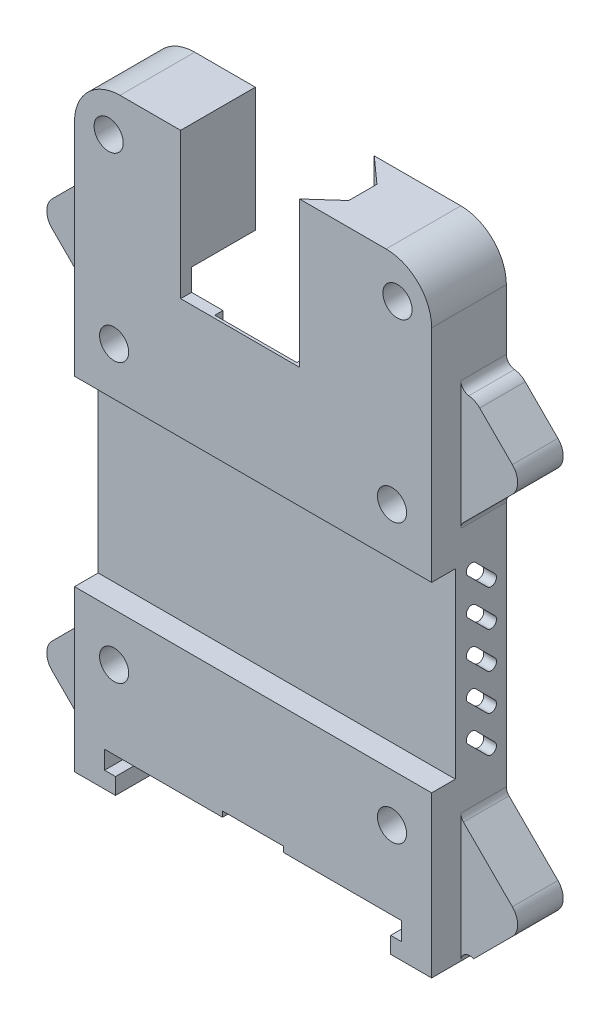
from build123d import *

# Parameters (mm, degrees)
BASE_BODY_DEPTH                     = 8.2
PCB_START                           = -1.95
SKETCH5_W                           = 36.4
SKETCH5_H                           = 46.4
PCB_CUT_DEPTH                       = 1.95
BOTTOM_REACH                        = 57.07
SKETCH7_W                           = 1.2
SKETCH7_H                           = 46.4
SKETCH7_W_2                         = 3.6
SKETCH7_H_2                         = 22
HOLE_CUT_REACH                      = 46.382
SKETCH25_R                          = 1.6
HOLE_CUT_DIRECTION_2_REACH          = 46.382
BATTERY_STRAP_CUT_REACH             = 57.07
SKETCH9_W                           = 2.6
SKETCH9_H                           = 20
BATTERY_STRAP_CUT_DIRECTION_2_REACH = 57.07
SKETCH11_W                          = 4.5
SKETCH11_H                          = 8.2
LED_STRIP_HOLDER_DEPTH              = 3
LED_STRIP_CUT_REACH                 = 46.587
SKETCH14_W                          = 32.6
SKETCH14_H                          = 2
SKETCH15_R                          = 0.8
LED_STRIP_HOLE_HOLDER_DEPTH         = 0.7
LED_STRIP_WIRE_HOLE_REACH           = 67.918
XT60_CUT_DEPTH                      = 16
SKETCH21_W                          = 8.85
SKETCH21_H                          = 9
WIRE_POCKET_DEPTH                   = 7
ESC_WIRE_EXTRUDE_DEPTH              = 5
ESC_WIRE_POCKET_DEPTH               = 3.8
MIRROR_TOP_BOTTOM_COPY_1_DEPTH      = 5
MIRROR_TOP_BOTTOM_COPY_2_DEPTH      = 3.8
INNER_FILLET_R                      = 2
OUTER_FILLET_R                      = 1
FILLET2_R                           = 2
VENTILATION_CUT_DEPTH               = 61.571557621
VENTILATION_CUT_DEPTH_BACK          = 61.571557621
FILLET1_R                           = 5
CAPACITOR_CUT_REACH                 = 49.663
SKETCH26_W                          = 18.7
SKETCH26_H                          = 2.4
SKETCH27_W                          = 9
SKETCH27_H                          = 11.6
CUT_EXTRUDE2_DEPTH                  = 0.9
CUT_EXTRUDE3_REACH                  = 49.663
SKETCH28_W                          = 6.7
SKETCH28_H                          = 0.6


with BuildPart() as part:
    # Sketch3 → Base body (new body)
    with BuildSketch(Plane.XY):
        Polygon((-18.2, 23.2), (-7.85, 23.2), (-7.85, 39.2), (-19.6, 39.2), (-19.6, -24.6), (19.6, -24.6), (19.6, 39.2), (4.95, 39.2), (4.95, 23.2), (18.2, 23.2), (18.2, 18.2), (18.2, 15.25), (18.2, 12.3), (18.2, -12.3), (18.2, -15.25), (18.2, -18.2), (18.2, -23.2), (-18.2, -23.2), (-18.2, -18.2), (-18.2, -15.25), (-18.2, -12.3), (-18.2, 12.3), (-18.2, 15.249999986), (-18.2, 18.2), align=None)
        with BuildLine():
            Line((-15.25, 18.2), (-18, 18.2))
            Line((-18, 18.2), (-18, 16.317707825))
            ThreePointArc((-18, 16.317707825), (-16.916247568, 17.684362143), (-15.25, 18.2))
        make_face()
        with BuildLine():
            ThreePointArc((-15.25, 18.2), (-16.916247568, 17.684362143), (-18, 16.317707825))
            Line((-18, 16.317707825), (-18, 14.182292175))
            ThreePointArc((-18, 14.182292175), (-16.916247568, 12.815637857), (-15.25, 12.3))
            ThreePointArc((-15.25, 12.3), (-13.164034995, 13.164034995), (-12.3, 15.25))
            ThreePointArc((-12.3, 15.25), (-13.164034995, 17.335965005), (-15.25, 18.2))
        make_face()
        with BuildLine():
            ThreePointArc((-15.25, 12.3), (-16.916247568, 12.815637857), (-18, 14.182292175))
            Line((-18, 14.182292175), (-18, 12.3))
            Line((-18, 12.3), (-15.25, 12.3))
        make_face()
        with BuildLine():
            Line((18, 16.317707825), (18, 18.2))
            Line((18, 18.2), (15.25, 18.2))
            ThreePointArc((15.25, 18.2), (16.916247568, 17.684362143), (18, 16.317707825))
        make_face()
        with BuildLine():
            Line((18, 12.3), (18, 14.182292175))
            ThreePointArc((18, 14.182292175), (16.916247568, 12.815637857), (15.25, 12.3))
            Line((15.25, 12.3), (18, 12.3))
        make_face()
        with BuildLine():
            Line((18, 14.182292175), (18, 16.317707825))
            ThreePointArc((18, 16.317707825), (16.916247568, 17.684362143), (15.25, 18.2))
            ThreePointArc((15.25, 18.2), (12.3, 15.25), (15.25, 12.3))
            ThreePointArc((15.25, 12.3), (16.916247568, 12.815637857), (18, 14.182292175))
        make_face()
        with BuildLine():
            Line((18, -16.317707825), (18, -14.182292175))
            ThreePointArc((18, -14.182292175), (16.916247568, -12.815637857), (15.25, -12.3))
            ThreePointArc((15.25, -12.3), (12.3, -15.25), (15.25, -18.2))
            ThreePointArc((15.25, -18.2), (16.916247568, -17.684362143), (18, -16.317707825))
        make_face()
        with BuildLine():
            Line((18, -14.182292175), (18, -12.3))
            Line((18, -12.3), (15.25, -12.3))
            ThreePointArc((15.25, -12.3), (16.916247568, -12.815637857), (18, -14.182292175))
        make_face()
        with BuildLine():
            Line((18, -18.2), (18, -16.317707825))
            ThreePointArc((18, -16.317707825), (16.916247568, -17.684362143), (15.25, -18.2))
            Line((15.25, -18.2), (18, -18.2))
        make_face()
        with BuildLine():
            ThreePointArc((-15.25, -12.3), (-16.916247568, -12.815637857), (-18, -14.182292175))
            Line((-18, -14.182292175), (-18, -16.317707825))
            ThreePointArc((-18, -16.317707825), (-16.916247568, -17.684362143), (-15.25, -18.2))
            ThreePointArc((-15.25, -18.2), (-13.164034995, -17.335965005), (-12.3, -15.25))
            ThreePointArc((-12.3, -15.25), (-13.164034995, -13.164034995), (-15.25, -12.3))
        make_face()
        with BuildLine():
            Line((-15.25, -12.3), (-18, -12.3))
            Line((-18, -12.3), (-18, -14.182292175))
            ThreePointArc((-18, -14.182292175), (-16.916247568, -12.815637857), (-15.25, -12.3))
        make_face()
        with BuildLine():
            ThreePointArc((-15.25, -18.2), (-16.916247568, -17.684362143), (-18, -16.317707825))
            Line((-18, -16.317707825), (-18, -18.2))
            Line((-18, -18.2), (-15.25, -18.2))
        make_face()
        with BuildLine():
            Line((-18, -14.182292175), (-18, -12.3))
            Line((-18, -12.3), (-18.2, -12.3))
            Line((-18.2, -12.3), (-18.2, -15.25))
            ThreePointArc((-18.2, -15.25), (-18.149568933, -14.706860975), (-18, -14.182292175))
        make_face()
        with BuildLine():
            Line((-18, -16.317707825), (-18, -14.182292175))
            ThreePointArc((-18, -14.182292175), (-18.149568933, -14.706860975), (-18.2, -15.25))
            ThreePointArc((-18.2, -15.25), (-18.149568933, -15.793139025), (-18, -16.317707825))
        make_face()
        with BuildLine():
            ThreePointArc((-18, -16.317707825), (-18.149568933, -15.793139025), (-18.2, -15.25))
            Line((-18.2, -15.25), (-18.2, -18.2))
            Line((-18.2, -18.2), (-18, -18.2))
            Line((-18, -18.2), (-18, -16.317707825))
        make_face()
        with BuildLine():
            Line((-18, 16.317707825), (-18, 18.2))
            Line((-18, 18.2), (-18.2, 18.2))
            Line((-18.2, 18.2), (-18.2, 15.249999986))
            ThreePointArc((-18.2, 15.249999986), (-18.149568935, 15.793139017), (-18, 16.317707825))
        make_face()
        with BuildLine():
            Line((-18, 14.182292175), (-18, 16.317707825))
            ThreePointArc((-18, 16.317707825), (-18.149568935, 15.793139017), (-18.2, 15.249999986))
            ThreePointArc((-18.2, 15.249999986), (-18.149568932, 14.706860968), (-18, 14.182292175))
        make_face()
        with BuildLine():
            Line((-18, 12.3), (-18, 14.182292175))
            ThreePointArc((-18, 14.182292175), (-18.149568932, 14.706860968), (-18.2, 15.249999986))
            Line((-18.2, 15.249999986), (-18.2, 12.3))
            Line((-18.2, 12.3), (-18, 12.3))
        make_face()
        with BuildLine():
            Line((18.2, 18.2), (18, 18.2))
            Line((18, 18.2), (18, 16.317707825))
            ThreePointArc((18, 16.317707825), (18.149568933, 15.793139025), (18.2, 15.25))
            Line((18.2, 15.25), (18.2, 18.2))
        make_face()
        with BuildLine():
            ThreePointArc((18.2, 15.25), (18.149568933, 15.793139025), (18, 16.317707825))
            Line((18, 16.317707825), (18, 14.182292175))
            ThreePointArc((18, 14.182292175), (18.149568933, 14.706860975), (18.2, 15.25))
        make_face()
        with BuildLine():
            ThreePointArc((18.2, 15.25), (18.149568933, 14.706860975), (18, 14.182292175))
            Line((18, 14.182292175), (18, 12.3))
            Line((18, 12.3), (18.2, 12.3))
            Line((18.2, 12.3), (18.2, 15.25))
        make_face()
        with BuildLine():
            Line((18.2, -12.3), (18, -12.3))
            Line((18, -12.3), (18, -14.182292175))
            ThreePointArc((18, -14.182292175), (18.149568933, -14.706860975), (18.2, -15.25))
            Line((18.2, -15.25), (18.2, -12.3))
        make_face()
        with BuildLine():
            ThreePointArc((18.2, -15.25), (18.149568933, -14.706860975), (18, -14.182292175))
            Line((18, -14.182292175), (18, -16.317707825))
            ThreePointArc((18, -16.317707825), (18.149568933, -15.793139025), (18.2, -15.25))
        make_face()
        with BuildLine():
            Line((18.2, -18.2), (18.2, -15.25))
            ThreePointArc((18.2, -15.25), (18.149568933, -15.793139025), (18, -16.317707825))
            Line((18, -16.317707825), (18, -18.2))
            Line((18, -18.2), (18.2, -18.2))
        make_face()
    extrude(amount=BASE_BODY_DEPTH)

    # Sketch5 → PCB cut (cut)
    with BuildSketch(Plane(origin=(0, 0, 0), x_dir=(-1, 0, 0), z_dir=(0, 0, -1)).offset(PCB_START)):
        Rectangle(SKETCH5_W, SKETCH5_H)
    extrude(amount=PCB_CUT_DEPTH, mode=Mode.SUBTRACT)

    # Bottom: up to this face of the body (flat: up to its plane)
    bottom_end = Plane(part.part.faces().sort_by_distance((18.2, 0, 3.865571512))[0])
    # Sketch7 → Bottom (add, up to the picked face)
    with BuildSketch(Plane(origin=(-18.2, 0, 0), x_dir=(0, 0, -1), z_dir=(1, 0, 0)), mode=Mode.PRIVATE) as bottom_sk1:
        with Locations((-7.6, 0)):
            Rectangle(SKETCH7_W, SKETCH7_H)
    bottom_tool1 = split(extrude(bottom_sk1.sketch, amount=BOTTOM_REACH, mode=Mode.PRIVATE), bisect_by=bottom_end, keep=Keep.BOTH, mode=Mode.PRIVATE)
    # Sketch7 → Bottom (add, up to the picked face)
    with BuildSketch(Plane(origin=(-18.2, 0, 0), x_dir=(0, 0, -1), z_dir=(1, 0, 0)), mode=Mode.PRIVATE) as bottom_sk2:
        with Locations((-6.4, 0)):
            Rectangle(SKETCH7_W_2, SKETCH7_H_2)
    bottom_tool2 = split(extrude(bottom_sk2.sketch, amount=BOTTOM_REACH, mode=Mode.PRIVATE), bisect_by=bottom_end, keep=Keep.BOTH, mode=Mode.PRIVATE)
    add(bottom_tool1.solids().sort_by(Axis((-18.2, 0, 7.6), (1, 0, 0)))[0])
    add(bottom_tool2.solids().sort_by(Axis((-18.2, 0, 6.4), (1, 0, 0)))[0])

    # Sketch25 → Hole cut (cut, up to next)
    with BuildSketch(Plane(origin=(0, 0, 7), x_dir=(-1, 0, 0), z_dir=(0, 0, -1)), mode=Mode.PRIVATE) as hole_cut_sk1:
        with Locations(Location((-15.25, 15.25, 0), (0, 0, 180))):
            Circle(SKETCH25_R)
    hole_cut_tool1 = extrude(hole_cut_sk1.sketch, amount=-HOLE_CUT_REACH, mode=Mode.PRIVATE) & part.part
    # Sketch25 → Hole cut (cut, up to next)
    with BuildSketch(Plane(origin=(0, 0, 7), x_dir=(-1, 0, 0), z_dir=(0, 0, -1)), mode=Mode.PRIVATE) as hole_cut_sk2:
        with Locations(Location((15.25, 15.25, 0), (0, 0, 180))):
            Circle(SKETCH25_R)
    hole_cut_tool2 = extrude(hole_cut_sk2.sketch, amount=-HOLE_CUT_REACH, mode=Mode.PRIVATE) & part.part
    # Sketch25 → Hole cut (cut, up to next)
    with BuildSketch(Plane(origin=(0, 0, 7), x_dir=(-1, 0, 0), z_dir=(0, 0, -1)), mode=Mode.PRIVATE) as hole_cut_sk3:
        with Locations(Location((-15.25, -15.25, 0), (0, 0, 180))):
            Circle(SKETCH25_R)
    hole_cut_tool3 = extrude(hole_cut_sk3.sketch, amount=-HOLE_CUT_REACH, mode=Mode.PRIVATE) & part.part
    # Sketch25 → Hole cut (cut, up to next)
    with BuildSketch(Plane(origin=(0, 0, 7), x_dir=(-1, 0, 0), z_dir=(0, 0, -1)), mode=Mode.PRIVATE) as hole_cut_sk4:
        with Locations(Location((15.25, -15.25, 0), (0, 0, 180))):
            Circle(SKETCH25_R)
    hole_cut_tool4 = extrude(hole_cut_sk4.sketch, amount=-HOLE_CUT_REACH, mode=Mode.PRIVATE) & part.part
    # Sketch25 → Hole cut (cut, up to next)
    with BuildSketch(Plane(origin=(0, 0, 7), x_dir=(-1, 0, 0), z_dir=(0, 0, -1)), mode=Mode.PRIVATE) as hole_cut_sk5:
        with Locations(Location((15.85, 34.85, 0), (0, 0, 180))):
            Circle(SKETCH25_R)
    hole_cut_tool5 = extrude(hole_cut_sk5.sketch, amount=-HOLE_CUT_REACH, mode=Mode.PRIVATE) & part.part
    # Sketch25 → Hole cut (cut, up to next)
    with BuildSketch(Plane(origin=(0, 0, 7), x_dir=(-1, 0, 0), z_dir=(0, 0, -1)), mode=Mode.PRIVATE) as hole_cut_sk6:
        with Locations(Location((-15.85, 34.85, 0), (0, 0, 180))):
            Circle(SKETCH25_R)
    hole_cut_tool6 = extrude(hole_cut_sk6.sketch, amount=-HOLE_CUT_REACH, mode=Mode.PRIVATE) & part.part
    add(hole_cut_tool1.solids().sort_by_distance((15.25, 15.25, 7))[0], mode=Mode.SUBTRACT)
    add(hole_cut_tool2.solids().sort_by_distance((-15.25, 15.25, 7))[0], mode=Mode.SUBTRACT)
    add(hole_cut_tool3.solids().sort_by_distance((15.25, -15.25, 7))[0], mode=Mode.SUBTRACT)
    add(hole_cut_tool4.solids().sort_by_distance((-15.25, -15.25, 7))[0], mode=Mode.SUBTRACT)
    add(hole_cut_tool5.solids().sort_by_distance((-15.85, 34.85, 7))[0], mode=Mode.SUBTRACT)
    add(hole_cut_tool6.solids().sort_by_distance((15.85, 34.85, 7))[0], mode=Mode.SUBTRACT)

    # Sketch25 → Hole cut direction 2 (cut, up to next)
    with BuildSketch(Plane(origin=(0, 0, 7), x_dir=(-1, 0, 0), z_dir=(0, 0, -1)), mode=Mode.PRIVATE) as hole_cut_direction_2_sk1:
        with Locations(Location((-15.25, 15.25, 0), (0, 0, 180))):
            Circle(SKETCH25_R)
    hole_cut_direction_2_tool1 = extrude(hole_cut_direction_2_sk1.sketch, amount=HOLE_CUT_DIRECTION_2_REACH, mode=Mode.PRIVATE) & part.part
    # Sketch25 → Hole cut direction 2 (cut, up to next)
    with BuildSketch(Plane(origin=(0, 0, 7), x_dir=(-1, 0, 0), z_dir=(0, 0, -1)), mode=Mode.PRIVATE) as hole_cut_direction_2_sk2:
        with Locations(Location((15.25, 15.25, 0), (0, 0, 180))):
            Circle(SKETCH25_R)
    hole_cut_direction_2_tool2 = extrude(hole_cut_direction_2_sk2.sketch, amount=HOLE_CUT_DIRECTION_2_REACH, mode=Mode.PRIVATE) & part.part
    # Sketch25 → Hole cut direction 2 (cut, up to next)
    with BuildSketch(Plane(origin=(0, 0, 7), x_dir=(-1, 0, 0), z_dir=(0, 0, -1)), mode=Mode.PRIVATE) as hole_cut_direction_2_sk3:
        with Locations(Location((-15.25, -15.25, 0), (0, 0, 180))):
            Circle(SKETCH25_R)
    hole_cut_direction_2_tool3 = extrude(hole_cut_direction_2_sk3.sketch, amount=HOLE_CUT_DIRECTION_2_REACH, mode=Mode.PRIVATE) & part.part
    # Sketch25 → Hole cut direction 2 (cut, up to next)
    with BuildSketch(Plane(origin=(0, 0, 7), x_dir=(-1, 0, 0), z_dir=(0, 0, -1)), mode=Mode.PRIVATE) as hole_cut_direction_2_sk4:
        with Locations(Location((15.25, -15.25, 0), (0, 0, 180))):
            Circle(SKETCH25_R)
    hole_cut_direction_2_tool4 = extrude(hole_cut_direction_2_sk4.sketch, amount=HOLE_CUT_DIRECTION_2_REACH, mode=Mode.PRIVATE) & part.part
    # Sketch25 → Hole cut direction 2 (cut, up to next)
    with BuildSketch(Plane(origin=(0, 0, 7), x_dir=(-1, 0, 0), z_dir=(0, 0, -1)), mode=Mode.PRIVATE) as hole_cut_direction_2_sk5:
        with Locations(Location((15.85, 34.85, 0), (0, 0, 180))):
            Circle(SKETCH25_R)
    hole_cut_direction_2_tool5 = extrude(hole_cut_direction_2_sk5.sketch, amount=HOLE_CUT_DIRECTION_2_REACH, mode=Mode.PRIVATE) & part.part
    # Sketch25 → Hole cut direction 2 (cut, up to next)
    with BuildSketch(Plane(origin=(0, 0, 7), x_dir=(-1, 0, 0), z_dir=(0, 0, -1)), mode=Mode.PRIVATE) as hole_cut_direction_2_sk6:
        with Locations(Location((-15.85, 34.85, 0), (0, 0, 180))):
            Circle(SKETCH25_R)
    hole_cut_direction_2_tool6 = extrude(hole_cut_direction_2_sk6.sketch, amount=HOLE_CUT_DIRECTION_2_REACH, mode=Mode.PRIVATE) & part.part
    add(hole_cut_direction_2_tool1.solids().sort_by_distance((15.25, 15.25, 7))[0], mode=Mode.SUBTRACT)
    add(hole_cut_direction_2_tool2.solids().sort_by_distance((-15.25, 15.25, 7))[0], mode=Mode.SUBTRACT)
    add(hole_cut_direction_2_tool3.solids().sort_by_distance((15.25, -15.25, 7))[0], mode=Mode.SUBTRACT)
    add(hole_cut_direction_2_tool4.solids().sort_by_distance((-15.25, -15.25, 7))[0], mode=Mode.SUBTRACT)
    add(hole_cut_direction_2_tool5.solids().sort_by_distance((-15.85, 34.85, 7))[0], mode=Mode.SUBTRACT)
    add(hole_cut_direction_2_tool6.solids().sort_by_distance((15.85, 34.85, 7))[0], mode=Mode.SUBTRACT)

    # Sketch9 → Battery strap cut (cut, up to next)
    with BuildSketch(Plane(origin=(-18.2, 0, 0), x_dir=(0, 0, -1), z_dir=(1, 0, 0)), mode=Mode.PRIVATE) as battery_strap_cut_sk1:
        with Locations((-6.9, 0)):
            Rectangle(SKETCH9_W, SKETCH9_H)
    battery_strap_cut_tool1 = extrude(battery_strap_cut_sk1.sketch, amount=BATTERY_STRAP_CUT_REACH, mode=Mode.PRIVATE) & part.part
    add(battery_strap_cut_tool1.solids().sort_by_distance((-18.2, 0, 6.9))[0], mode=Mode.SUBTRACT)

    # Sketch9 → Battery strap cut direction 2 (cut, up to next)
    with BuildSketch(Plane(origin=(-18.2, 0, 0), x_dir=(0, 0, -1), z_dir=(1, 0, 0)), mode=Mode.PRIVATE) as battery_strap_cut_direction_2_sk1:
        with Locations((-6.9, 0)):
            Rectangle(SKETCH9_W, SKETCH9_H)
    battery_strap_cut_direction_2_tool1 = extrude(battery_strap_cut_direction_2_sk1.sketch, amount=-BATTERY_STRAP_CUT_DIRECTION_2_REACH, mode=Mode.PRIVATE) & part.part
    add(battery_strap_cut_direction_2_tool1.solids().sort_by_distance((-18.2, 0, 6.9))[0], mode=Mode.SUBTRACT)

    # Sketch11 → Led strip holder (add)
    with BuildSketch(Plane.XZ.offset(24.6)):
        with Locations((17.35, 4.1)):
            Rectangle(SKETCH11_W, SKETCH11_H)
        with Locations((-17.35, 4.1)):
            Rectangle(SKETCH11_W, SKETCH11_H)
    extrude(amount=LED_STRIP_HOLDER_DEPTH)

    # Sketch14 → Led strip cut (cut, up to next)
    with BuildSketch(Plane.XY.offset(8.2), mode=Mode.PRIVATE) as led_strip_cut_sk1:
        with Locations((0, -24.8)):
            Rectangle(SKETCH14_W, SKETCH14_H)
    led_strip_cut_tool1 = extrude(led_strip_cut_sk1.sketch, amount=-LED_STRIP_CUT_REACH, mode=Mode.PRIVATE) & part.part
    add(led_strip_cut_tool1.solids().sort_by_distance((0, -24.8, 8.2))[0], mode=Mode.SUBTRACT)

    # Sketch15 → Led strip hole holder (add)
    with BuildSketch(Plane.XZ.offset(23.8)):
        with Locations(Location((-8, 1.35, 0), (0, 0, 270))):
            Circle(SKETCH15_R)
        with Locations(Location((8, 1.35, 0), (0, 0, 270))):
            Circle(SKETCH15_R)
    extrude(amount=LED_STRIP_HOLE_HOLDER_DEPTH)

    # Sketch20 → Led strip wire hole (cut, up to next)
    with BuildSketch(Plane(origin=(0, -23.2, 0), x_dir=(1, 0, 0), z_dir=(0, 1, 0)), mode=Mode.PRIVATE) as led_strip_wire_hole_sk1:
        with BuildLine():
            Line((4, -6.2998283), (-4, -6.2998283))
            ThreePointArc((-4, -6.2998283), (-5.5998283, -4.7), (-4, -3.1001717))
            Line((-4, -3.1001717), (4, -3.1001717))
            ThreePointArc((4, -3.1001717), (5.5998283, -4.7), (4, -6.2998283))
        make_face()
    led_strip_wire_hole_tool1 = extrude(led_strip_wire_hole_sk1.sketch, amount=-LED_STRIP_WIRE_HOLE_REACH, mode=Mode.PRIVATE) & part.part
    add(led_strip_wire_hole_tool1.solids().sort_by_distance((0, -23.2, 4.7))[0], mode=Mode.SUBTRACT)

    # Sketch16 → XT60 cut (cut)
    with BuildSketch(Plane(origin=(0, 39.2, 0), x_dir=(1, 0, 0), z_dir=(0, 1, 0))):
        Polygon((-7.95, 0), (5.099802631, 0), (7.95, -2.555349365), (7.95, -5.644650635), (5.099802631, -8.2), (-7.95, -8.2), align=None)
    extrude(amount=-XT60_CUT_DEPTH, mode=Mode.SUBTRACT)

    # Sketch21 → Wire pocket (cut)
    with BuildSketch(Plane(origin=(0, 0, 0), x_dir=(-1, 0, 0), z_dir=(0, 0, -1))):
        with Locations((13.775, 27.7)):
            Rectangle(SKETCH21_W, SKETCH21_H)
        with Locations((-13.775, 27.7)):
            Rectangle(SKETCH21_W, SKETCH21_H)
    extrude(amount=-WIRE_POCKET_DEPTH, mode=Mode.SUBTRACT)

    # Sketch22 → ESC wire extrude (add)
    with BuildSketch(Plane.XY):
        Polygon((-19.6, 13.943145751), (-26.671067812, 21.014213562), (-21.014213562, 26.671067812), (-19.6, 25.256854249), align=None)
    esc_wire_extrude = extrude(amount=ESC_WIRE_EXTRUDE_DEPTH)

    # Sketch23 → ESC wire pocket (cut)
    with BuildSketch(Plane(origin=(0, 0, 0), x_dir=(-1, 0, 0), z_dir=(0, 0, -1))):
        Polygon((18.2, 24.408326112), (18.2, 18.2), (22.159797975, 18.2), (24.974011537, 21.014213562), (21.014213562, 24.974011537), (20.448528137, 24.408326112), align=None)
    esc_wire_pocket = extrude(amount=-ESC_WIRE_POCKET_DEPTH, mode=Mode.SUBTRACT)

    # Mirror left-right: ESC wire extrude, ESC wire pocket across plane
    add(esc_wire_extrude.mirror(Plane(origin=(0, 0, 0), x_dir=(0, 0, 1), z_dir=(1, 0, 0))))
    add(esc_wire_pocket.mirror(Plane(origin=(0, 0, 0), x_dir=(0, 0, 1), z_dir=(1, 0, 0))), mode=Mode.SUBTRACT)

    # Mirror top-bottom: ESC wire extrude, ESC wire pocket across plane
    add(esc_wire_extrude.mirror(Plane.ZX))
    add(esc_wire_pocket.mirror(Plane.ZX), mode=Mode.SUBTRACT)

    # Mirror top-bottom copy 1 sketch → Mirror top-bottom copy 1 (add)
    with BuildSketch(Plane(origin=(0, 0, 0), x_dir=(-1, 0, 0), z_dir=(0, 0, 1))):
        Polygon((-19.6, 13.943145751), (-26.671067812, 21.014213562), (-21.014213562, 26.671067812), (-19.6, 25.256854249), align=None)
    extrude(amount=MIRROR_TOP_BOTTOM_COPY_1_DEPTH)

    # Mirror top-bottom copy 2 sketch → Mirror top-bottom copy 2 (cut)
    with BuildSketch(Plane(origin=(0, 0, 0), x_dir=(1, 0, 0), z_dir=(0, 0, -1))):
        Polygon((18.2, 24.408326112), (18.2, 18.2), (22.159797975, 18.2), (24.974011537, 21.014213562), (21.014213562, 24.974011537), (20.448528137, 24.408326112), align=None)
    extrude(amount=-MIRROR_TOP_BOTTOM_COPY_2_DEPTH, mode=Mode.SUBTRACT)

    # Inner fillet
    inner_fillet_edges = [part.edges().sort_by_distance(p)[0] for p in [
        (-18.2, 24.408326112, 1.9),
        (-18.2, 21.304163056, 3.8),
        (18.2, 21.304163056, 3.8),
        (18.2, 24.408326112, 1.9),
        (18.2, -20.7, 3.8),
        (-18.2, -20.7, 3.8),
    ]]
    fillet(inner_fillet_edges, radius=INNER_FILLET_R)

    # Outer fillet
    # the kernel refuses this fillet: 1 mm, written as the material it adds along each edge
    with BuildSketch(Plane(origin=(-19.6, 13.943145751, 0), x_dir=(0, -1, 0), z_dir=(0, 0, 1)), Plane(origin=(19.6, -13.943145751, 0), x_dir=(0, 1, 0), z_dir=(0, 0, 1))) as outer_fillet_piece_1:
        with BuildLine():
            CenterArc((OUTER_FILLET_R * 0.414213562373, -OUTER_FILLET_R), OUTER_FILLET_R, 90, 45)
            Line((-OUTER_FILLET_R * 0.292893218813, -OUTER_FILLET_R * 0.292893218813), (0, 0))
            Line((0, 0), (OUTER_FILLET_R * 0.414213562373, 0))
        make_face()
    extrude(amount=5)
    with BuildSketch(Plane(origin=(-19.6, 25.256854249, 0), x_dir=(0, 1, 0), z_dir=(0, 0, 1)), Plane(origin=(19.6, -25.256854249, 0), x_dir=(0, -1, 0), z_dir=(0, 0, 1))) as outer_fillet_piece_2:
        with BuildLine():
            CenterArc((2.324393283, 1), OUTER_FILLET_R, 155.530199479, 114.469800521)
            Line((1.414213562, 1.414213562), (0, 0))
            Line((0, 0), (2.324393283, 0))
        make_face()
    extrude(amount=5)
    with BuildSketch(Plane(origin=(19.6, 25.256854249, 0), x_dir=(0, 1, 0), z_dir=(0, 0, 1)), Plane(origin=(-19.6, -25.256854249, 0), x_dir=(0, -1, 0), z_dir=(0, 0, 1))) as outer_fillet_piece_3:
        with BuildLine():
            CenterArc((2.324393283, -1), OUTER_FILLET_R, 90, 114.469800521)
            Line((1.414213562, -1.414213562), (0, 0))
            Line((0, 0), (2.324393283, 0))
        make_face()
    extrude(amount=5)
    with BuildSketch(Plane(origin=(19.6, 13.943145751, 0), x_dir=(0, -1, 0), z_dir=(0, 0, 1)), Plane(origin=(-19.6, -13.943145751, 0), x_dir=(0, 1, 0), z_dir=(0, 0, 1))) as outer_fillet_piece_4:
        with BuildLine():
            CenterArc((OUTER_FILLET_R * 0.414213562373, OUTER_FILLET_R), OUTER_FILLET_R, 225, 45)
            Line((-OUTER_FILLET_R * 0.292893218813, OUTER_FILLET_R * 0.292893218813), (0, 0))
            Line((0, 0), (OUTER_FILLET_R * 0.414213562373, 0))
        make_face()
    extrude(amount=5)

    # Fillet2
    fillet2_edges = [part.edges().sort_by_distance(p)[0] for p in [
        (-21.014213562, 26.671067812, 2.5),
        (-26.671067812, 21.014213562, 2.5),
        (26.671067812, 21.014213562, 2.5),
        (21.014213562, 26.671067812, 2.5),
        (26.671067812, -21.014213562, 2.5),
        (-26.671067812, -21.014213562, 2.5),
    ]]
    fillet(fillet2_edges, radius=FILLET2_R)

    # Sketch24 → Ventilation cut (cut, two sides: drawn at the far end of the back side and taken through both)
    with BuildSketch(Plane.ZY.offset(19.6).offset(-VENTILATION_CUT_DEPTH_BACK)):
        with BuildLine():
            Line((4.220989636, 8.639670536), (2.099669292, 6.518350193))
            ThreePointArc((2.099669292, 6.518350193), (1.257690021, 6.518350193), (1.257690021, 7.360329464))
            Line((1.257690021, 7.360329464), (3.379010364, 9.481649807))
            ThreePointArc((3.379010364, 9.481649807), (4.220989636, 9.481649807), (4.220989636, 8.639670536))
        make_face()
        with BuildLine():
            Line((4.220989636, 4.639670536), (2.099669292, 2.518350193))
            ThreePointArc((2.099669292, 2.518350193), (1.257690021, 2.518350193), (1.257690021, 3.360329464))
            Line((1.257690021, 3.360329464), (3.379010364, 5.481649807))
            ThreePointArc((3.379010364, 5.481649807), (4.220989636, 5.481649807), (4.220989636, 4.639670536))
        make_face()
        with BuildLine():
            Line((4.220989636, 0.639670536), (2.099669292, -1.481649807))
            ThreePointArc((2.099669292, -1.481649807), (1.257690021, -1.481649807), (1.257690021, -0.639670536))
            Line((1.257690021, -0.639670536), (3.379010364, 1.481649807))
            ThreePointArc((3.379010364, 1.481649807), (4.220989636, 1.481649807), (4.220989636, 0.639670536))
        make_face()
        with BuildLine():
            Line((4.220989636, -3.360329464), (2.099669292, -5.481649807))
            ThreePointArc((2.099669292, -5.481649807), (1.257690021, -5.481649807), (1.257690021, -4.639670536))
            Line((1.257690021, -4.639670536), (3.379010364, -2.518350193))
            ThreePointArc((3.379010364, -2.518350193), (4.220989636, -2.518350193), (4.220989636, -3.360329464))
        make_face()
        with BuildLine():
            Line((4.220989636, -7.360329464), (2.099669292, -9.481649807))
            ThreePointArc((2.099669292, -9.481649807), (1.257690021, -9.481649807), (1.257690021, -8.639670536))
            Line((1.257690021, -8.639670536), (3.379010364, -6.518350193))
            ThreePointArc((3.379010364, -6.518350193), (4.220989636, -6.518350193), (4.220989636, -7.360329464))
        make_face()
    extrude(amount=VENTILATION_CUT_DEPTH + VENTILATION_CUT_DEPTH_BACK, mode=Mode.SUBTRACT)

    # Fillet1
    fillet1_edges = [part.edges().sort_by_distance(p)[0] for p in [
        (19.6, 39.2, 4.1),
        (-19.6, 39.2, 4.1),
    ]]
    fillet(fillet1_edges, radius=FILLET1_R)

    # Capacitor cut: up to this face of the body (flat: up to its plane)
    capacitor_cut_end = Plane(part.part.faces().sort_by_distance((0, 20.432328211, 7))[0])
    # Sketch26 → Capacitor cut (cut, up to the picked face)
    with BuildSketch(Plane(origin=(0, 0, 0), x_dir=(-1, 0, 0), z_dir=(0, 0, -1)), mode=Mode.PRIVATE) as capacitor_cut_sk1:
        with Locations((0, 24.4)):
            Rectangle(SKETCH26_W, SKETCH26_H)
    capacitor_cut_tool1 = split(extrude(capacitor_cut_sk1.sketch, amount=-CAPACITOR_CUT_REACH, mode=Mode.PRIVATE), bisect_by=capacitor_cut_end, keep=Keep.BOTH, mode=Mode.PRIVATE)
    add(capacitor_cut_tool1.solids().sort_by(Axis((0, 24.4, 0), (0, 0, 1)))[0], mode=Mode.SUBTRACT)

    # Sketch27 → Cut-Extrude2 (cut)
    with BuildSketch(Plane(origin=(0, 0, 7), x_dir=(-1, 0, 0), z_dir=(0, 0, -1))):
        with Locations((0, 17.4)):
            Rectangle(SKETCH27_W, SKETCH27_H)
    extrude(amount=-CUT_EXTRUDE2_DEPTH, mode=Mode.SUBTRACT)

    # Sketch28 → Cut-Extrude3 (cut, up to next)
    with BuildSketch(Plane.XY.offset(8.2), mode=Mode.PRIVATE) as cut_extrude3_sk1:
        with Locations((0, -23.5)):
            Rectangle(SKETCH28_W, SKETCH28_H)
    cut_extrude3_tool1 = extrude(cut_extrude3_sk1.sketch, amount=-CUT_EXTRUDE3_REACH, mode=Mode.PRIVATE) & part.part
    add(cut_extrude3_tool1.solids().sort_by_distance((0, -23.5, 8.2))[0], mode=Mode.SUBTRACT)


solid = part.part
